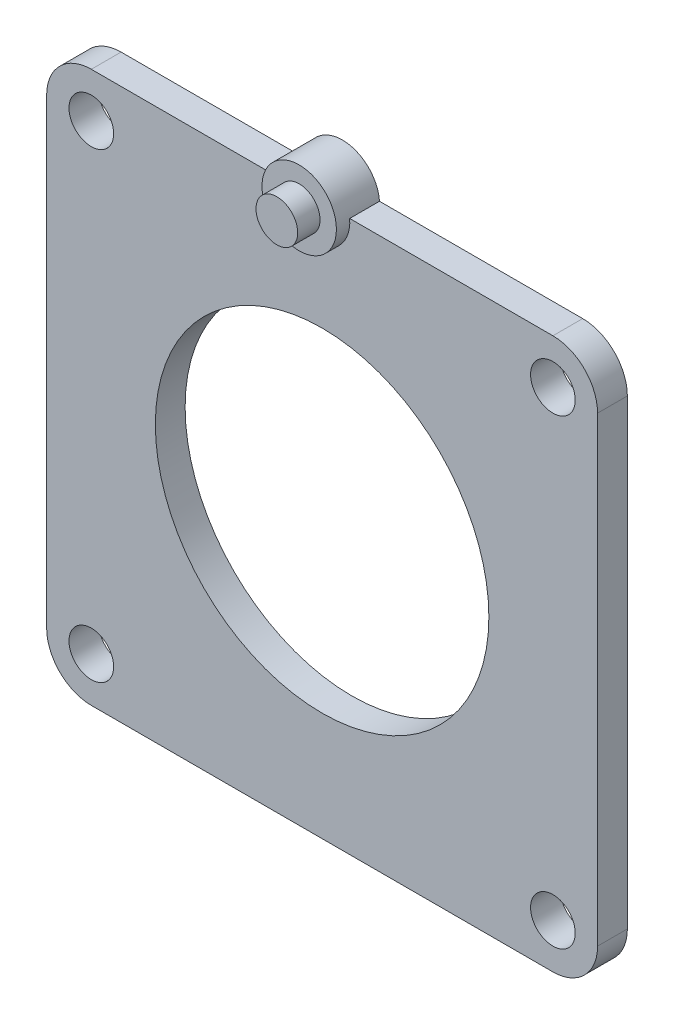
from build123d import *

# Parameters (mm, degrees)
SKETCH1_R      = 1.5
SKETCH1_R_2    = 11.2
EXTRUDE1_DEPTH = 2
SKETCH2_R      = 2.5
EXTRUDE2_DEPTH = 0.9
SKETCH3_R      = 1.4
EXTRUDE3_DEPTH = 1.5


with BuildPart() as part:
    # Sketch1 → Extrude1 (new body)
    with BuildSketch(Plane.XY):
        with BuildLine():
            Line((-18.5, 15.5), (-18.5, -15.5))
            ThreePointArc((-18.5, -15.5), (-17.621320344, -17.621320344), (-15.5, -18.5))
            Line((-15.5, -18.5), (15.5, -18.5))
            ThreePointArc((15.5, -18.5), (17.621320344, -17.621320344), (18.5, -15.5))
            Line((18.5, -15.5), (18.5, 15.5))
            ThreePointArc((18.5, 15.5), (17.621320344, 17.621320344), (15.5, 18.5))
            Line((15.5, 18.5), (1.853762559, 18.5))
            ThreePointArc((1.853762559, 18.5), (-0.639748006, 20.81998593), (-3.13325857, 18.5))
            Line((-3.13325857, 18.5), (-15.5, 18.5))
            ThreePointArc((-15.5, 18.5), (-17.621320344, 17.621320344), (-18.5, 15.5))
        make_face()
        with Locations((15.5, 15.5)):
            Circle(SKETCH1_R, mode=Mode.SUBTRACT)
        with Locations((-15.5, 15.5)):
            Circle(SKETCH1_R, mode=Mode.SUBTRACT)
        Circle(SKETCH1_R_2, mode=Mode.SUBTRACT)
        with Locations((15.5, -15.5)):
            Circle(SKETCH1_R, mode=Mode.SUBTRACT)
        with Locations((-15.5, -15.5)):
            Circle(SKETCH1_R, mode=Mode.SUBTRACT)
    extrude(amount=EXTRUDE1_DEPTH)

    # Sketch2 → Extrude2 (add)
    with BuildSketch(Plane.XY.offset(2)):
        with Locations((-0.639748006, 18.31998593)):
            Circle(SKETCH2_R)
    extrude(amount=EXTRUDE2_DEPTH)

    # Sketch3 → Extrude3 (add)
    with BuildSketch(Plane.XY.offset(2.9)):
        with Locations((-0.639748006, 18.31998593)):
            Circle(SKETCH3_R)
    extrude(amount=EXTRUDE3_DEPTH)


solid = part.part
